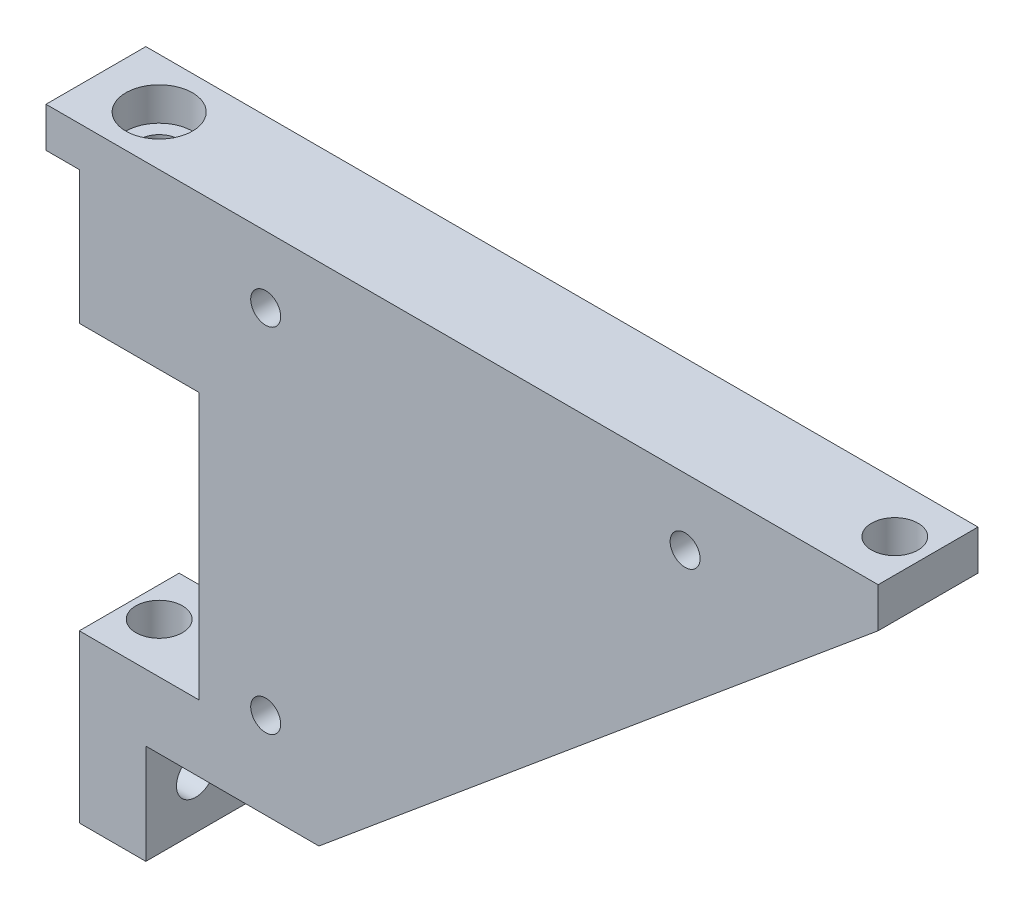
from build123d import *
from build123d.topology import SkipClean

# Parameters (mm, degrees)
BOSS_EXTRUDE1_DEPTH                = 7.5
CUT_EXTRUDE1_REACH                 = 158.924
SKETCH2_W                          = 18
SKETCH2_H                          = 40
M5_CLEARANCE_HOLE1_D               = 5.8
CUT_EXTRUDE2_REACH                 = 158.924
F_7_0_7_DIAMETER_HOLE1_D           = 7
F_7_0_7_DIAMETER_HOLE1_DEPTH       = 20
MOVE_FACE1_BY                      = 0.6
SKETCH15_W                         = 15
SKETCH15_H                         = 15
BOSS_EXTRUDE3_DEPTH                = 10
M5_CLEARANCE_HOLE2_D               = 5.8
SKETCH19_W                         = 125
SKETCH19_H                         = 15
SKETCH19_R                         = 3.5
SKETCH19_R_2                       = 5
BOSS_EXTRUDE4_DEPTH                = 6
SKETCH23_R                         = 5
SKETCH23_R_2                       = 2.9
BOSS_EXTRUDE5_DEPTH                = 1
F_4_5_START                        = -7.5
F_4_5_4_5_DIAMETER_HOLE1_OUTLINE_R = 2.25
F_4_5_4_5_DIAMETER_HOLE1_DEPTH     = 15


# Read off the part's stored shape, not the designer's step: Ø4.5 (4.5) Diameter Hole1
with BuildPart() as part:
    # Sketch1 → Boss-Extrude1 (new, symmetric)
    with BuildSketch(Plane.XY):
        Polygon((0, 0), (120, 0), (0, -100), align=None)
    extrude(amount=BOSS_EXTRUDE1_DEPTH, both=True)

    # Sketch2 → Cut-Extrude1 (cut, up to next)
    with BuildSketch(Plane.XY.offset(7.5), mode=Mode.PRIVATE) as cut_extrude1_sk1:
        with Locations((9, -40)):
            Rectangle(SKETCH2_W, SKETCH2_H)
    cut_extrude1_tool1 = extrude(cut_extrude1_sk1.sketch, amount=-CUT_EXTRUDE1_REACH, mode=Mode.PRIVATE) & part.part
    add(cut_extrude1_tool1.solids().sort_by_distance((9, -40, 7.5))[0], mode=Mode.SUBTRACT)

    # M5 Clearance Hole1 (through all)
    with Locations(Plane(origin=(0, 0, 0), x_dir=(1, 0, 0), z_dir=(0, 1, 0))):
        with Locations((4.5, 0)):
            Hole(M5_CLEARANCE_HOLE1_D / 2)

    # Sketch8 → Cut-Extrude2 (cut, up to next)
    with BuildSketch(Plane.XY.offset(7.5), mode=Mode.PRIVATE) as cut_extrude2_sk1:
        Polygon((0, -70), (36, -70), (0, -100), align=None)
    cut_extrude2_tool1 = extrude(cut_extrude2_sk1.sketch, amount=-CUT_EXTRUDE2_REACH, mode=Mode.PRIVATE) & part.part
    add(cut_extrude2_tool1.solids().sort_by_distance((12, -80, 7.5))[0], mode=Mode.SUBTRACT)

    # Ø7.0 (7) Diameter Hole1
    with Locations(Plane(origin=(0, 0, 0), x_dir=(1, 0, 0), z_dir=(0, 1, 0))):
        with Locations((115, 0)):
            Hole(F_7_0_7_DIAMETER_HOLE1_D / 2, depth=F_7_0_7_DIAMETER_HOLE1_DEPTH)

    # Move Face1: a curved face moved inward by 0.6
    add(Solid.thicken(part.faces().sort_by_distance((7.4, -65, 0))[0], -MOVE_FACE1_BY), mode=Mode.SUBTRACT)

    # Sketch15 → Boss-Extrude3 (add)
    with BuildSketch(Plane.ZY):
        with Locations((0, -77.5)):
            Rectangle(SKETCH15_W, SKETCH15_H)
    extrude(amount=-BOSS_EXTRUDE3_DEPTH)

    # M5 Clearance Hole2 (through all)
    with Locations(Plane(origin=(10, 0, 0), x_dir=(0, 0, -1), z_dir=(1, 0, 0))):
        with Locations((0, -77.5)):
            Hole(M5_CLEARANCE_HOLE2_D / 2)

    # Sketch19 → Boss-Extrude4 (add)
    with SkipClean():  # the faces are left unmerged after this step: merging them gives an invalid solid
        with BuildSketch(Plane(origin=(0, 0, 0), x_dir=(1, 0, 0), z_dir=(0, 1, 0))):
            with Locations((57.5, 0)):
                Rectangle(SKETCH19_W, SKETCH19_H)
            with Locations(Location((115, 0, 0), (0, 0, 270))):
                Circle(SKETCH19_R, mode=Mode.SUBTRACT)
            with Locations(Location((4.5, 0, 0), (0, 0, 154.158067237))):
                Circle(SKETCH19_R_2, mode=Mode.SUBTRACT)
        extrude(amount=BOSS_EXTRUDE4_DEPTH)

    # Sketch23 → Boss-Extrude5 (add)
    with BuildSketch(Plane(origin=(0, 0, 0), x_dir=(1, 0, 0), z_dir=(0, 1, 0))):
        with Locations(Location((4.5, 0, 0), (0, 0, 270))):
            Circle(SKETCH23_R)
        with Locations(Location((4.5, 0, 0), (0, 0, 270))):
            Circle(SKETCH23_R_2, mode=Mode.SUBTRACT)
    extrude(amount=BOSS_EXTRUDE5_DEPTH)

    # Ø4.5 (4.5) Diameter Hole1 outline → Ø4.5 (4.5) Diameter Hole1 (cut)
    with BuildSketch(Plane.XY.offset(F_4_5_START)):
        with Locations((91, -4)):
            Circle(F_4_5_4_5_DIAMETER_HOLE1_OUTLINE_R)
        with Locations((28, -57)):
            Circle(F_4_5_4_5_DIAMETER_HOLE1_OUTLINE_R)
        with Locations((28, -4)):
            Circle(F_4_5_4_5_DIAMETER_HOLE1_OUTLINE_R)
    extrude(amount=F_4_5_4_5_DIAMETER_HOLE1_DEPTH, mode=Mode.SUBTRACT)


solid = part.part
